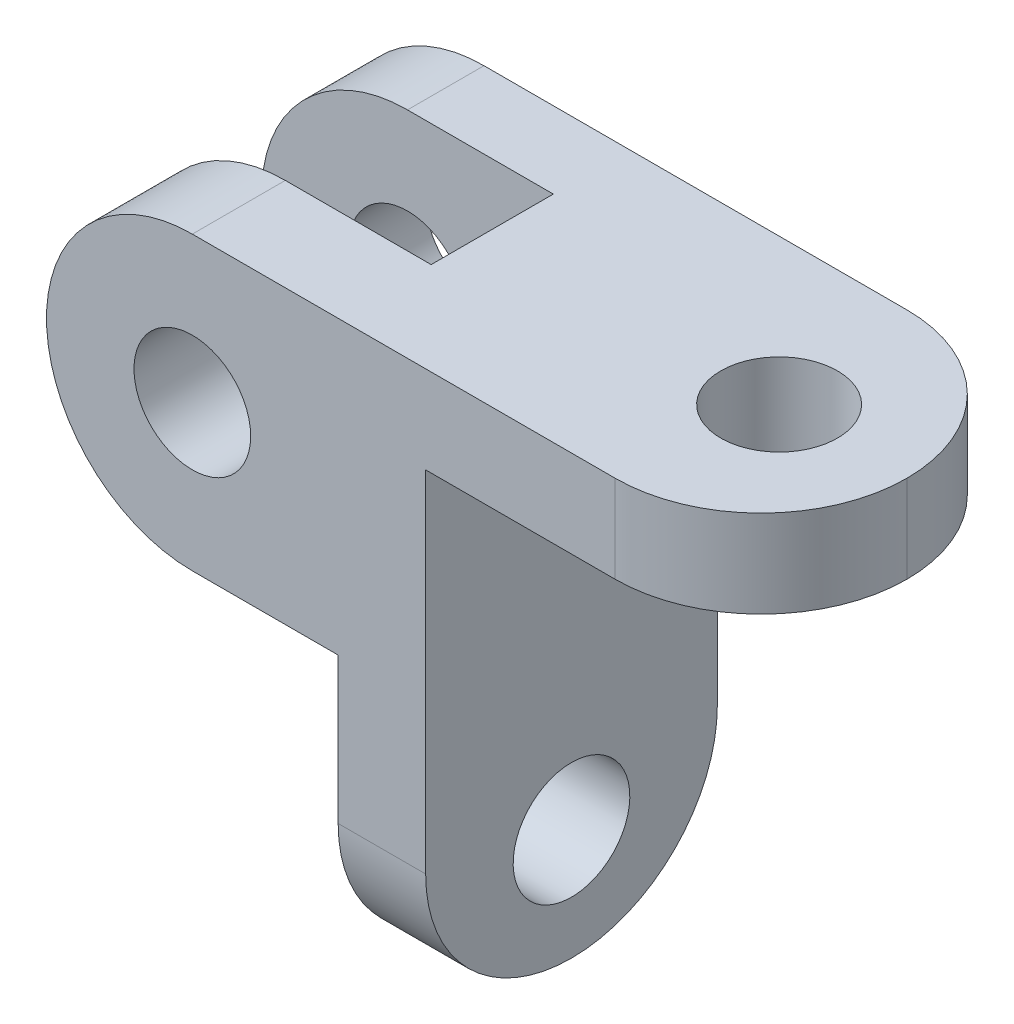
from build123d import *

# Parameters (mm, degrees)
SKETCH1_R               = 20
SKETCH1_R_2             = 8
BOSS_EXTRUDE1_DEPTH     = 20
FILLET1_R               = 20
SKETCH2_R               = 8
CUT_EXTRUDE2_DEPTH      = 16
SKETCH3_W               = 74.438735145
SKETCH3_H               = 16.753132604
CUT_EXTRUDE3_DEPTH      = 90.911067172
FILLET2_R               = 20
FILLET3_R               = 20
CUT_EXTRUDE4_DEPTH      = 82.877957962
CUT_EXTRUDE4_DEPTH_BACK = 82.877957962
SKETCH4_R               = 8


with BuildPart() as part:
    # Sketch1 → Boss-Extrude1 (new, symmetric)
    # profile 1 of 2: a face of its own
    with BuildSketch(Plane.XY):
        Circle(SKETCH1_R)
        Circle(SKETCH1_R_2, mode=Mode.SUBTRACT)
    # profile 2 of 2: a face of its own
    with BuildSketch(Plane.XY):
        with BuildLine():
            Line((78, 20), (0, 20))
            ThreePointArc((0, 20), (14.142135624, 14.142135624), (20, 0))
            ThreePointArc((20, 0), (14.142135624, -14.142135624), (0, -20))
            Line((0, -20), (20, -20))
            Line((20, -20), (20, -60))
            Line((20, -60), (32, -60))
            Line((32, -60), (32, 8))
            Line((32, 8), (78, 8))
            Line((78, 8), (78, 20))
        make_face()
    extrude(amount=BOSS_EXTRUDE1_DEPTH, both=True)

    # Fillet1
    fillet1_edges = [part.edges().sort_by_distance(p)[0] for p in [
        (78, 14, -20),
        (78, 14, 20),
    ]]
    fillet(fillet1_edges, radius=FILLET1_R - 0.0001)  # a hair under: the kernel refuses the full size

    # Sketch2 → Cut-Extrude2 (cut)
    with BuildSketch(Plane(origin=(0, 20, 0), x_dir=(1, 0, 0), z_dir=(0, 1, 0))):
        with Locations(Location((60.472902104, 0, 0), (0, 0, 180))):
            Circle(SKETCH2_R)
    extrude(amount=-CUT_EXTRUDE2_DEPTH, mode=Mode.SUBTRACT)

    # Sketch3 → Cut-Extrude3 (cut, through all)
    with BuildSketch(Plane.XZ.offset(20)):
        with Locations((-17.219367573, -1.130171644)):
            Rectangle(SKETCH3_W, SKETCH3_H)
    extrude(amount=-CUT_EXTRUDE3_DEPTH, mode=Mode.SUBTRACT)

    # Fillet2
    fillet2_edges = [part.edges().sort_by_distance(p)[0] for p in [
        (26, -60, 20),
    ]]
    fillet(fillet2_edges, radius=FILLET2_R)

    # Fillet3
    fillet3_edges = [part.edges().sort_by_distance(p)[0] for p in [
        (26, -60, -20),
    ]]
    fillet(fillet3_edges, radius=FILLET3_R - 0.0001)  # a hair under: the kernel refuses the full size

    # Sketch4 → Cut-Extrude4 (cut, two sides: drawn at the far end of the back side and taken through both)
    with BuildSketch(Plane(origin=(32, 0, 0), x_dir=(0, 0, -1), z_dir=(1, 0, 0)).offset(-CUT_EXTRUDE4_DEPTH_BACK)):
        with Locations(Location((0, -44.755854097, 0), (0, 0, 90))):
            Circle(SKETCH4_R)
    extrude(amount=CUT_EXTRUDE4_DEPTH + CUT_EXTRUDE4_DEPTH_BACK, mode=Mode.SUBTRACT)


solid = part.part
